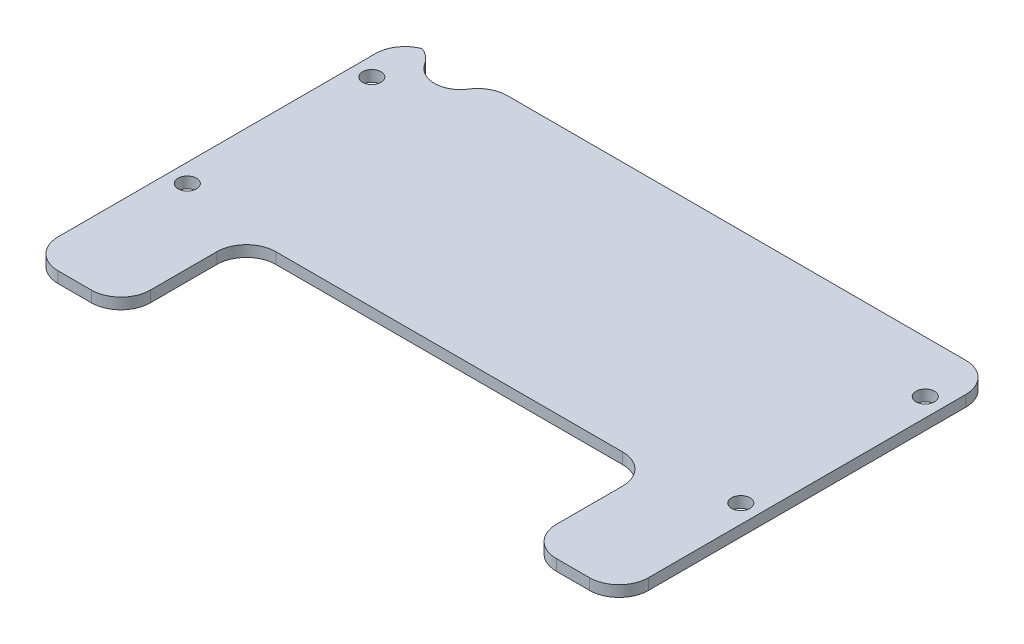
from build123d import *

# Parameters (mm, degrees)
ESQUISSE1_W             = 80
ESQUISSE1_H             = 51.00000000000001
BOSS_EXTRU_1_DEPTH      = 1.5
ESQUISSE2_R             = 1.2500000000000047
ESQUISSE2_R_2           = 1.250000000000005
ESQUISSE2_W             = 55.00000000000001
ESQUISSE2_H             = 17
ENL_V_MAT_EXTRU_1_DEPTH = 65.83247642964135
CONG_1_R                = 4


with BuildPart() as part:
    # Esquisse1 → Boss.-Extru.1 (new body)
    with BuildSketch(Plane(origin=(0, 0, 0), x_dir=(1, 0, 0), z_dir=(0, 1, 0))):
        with Locations((0, -25.500000000000004)):
            Rectangle(ESQUISSE1_W, ESQUISSE1_H)
    extrude(amount=BOSS_EXTRU_1_DEPTH)

    # Esquisse2 → Enlèv. mat.-Extru.1 (cut, through all)
    with BuildSketch(Plane(origin=(0, 1.5, 0), x_dir=(1, 0, 0), z_dir=(0, 1, 0))):
        with Locations(Location((-37.5, -32.00000000000001, 0), (0, 0, 270))):
            Circle(ESQUISSE2_R)
        with Locations(Location((-37.5, -7.000000000000006, 0), (0, 0, 270))):
            Circle(ESQUISSE2_R_2)
        with Locations(Location((37.5, -7.000000000000006, 0), (0, 0, 90))):
            Circle(ESQUISSE2_R_2)
        with Locations(Location((37.5, -32.00000000000001, 0), (0, 0, 90))):
            Circle(ESQUISSE2_R)
        with Locations((0, -42.49999999999999)):
            Rectangle(ESQUISSE2_W, ESQUISSE2_H)
        with BuildLine():
            Line((-36.00000000000001, -1.029e-14), (-29.000000000000004, -9.31e-15))
            ThreePointArc((-29.000000000000004, -9.31e-15), (-32.5, -3.5000000000000115), (-36.00000000000001, -1.029e-14))
        make_face()
    extrude(amount=-ENL_V_MAT_EXTRU_1_DEPTH, mode=Mode.SUBTRACT)

    # Congé1
    # the kernel refuses this fillet: 4 mm, written as the material it adds along each edge
    with BuildSketch(Plane(origin=(-27.5, 1.5, 33.99999999999999), x_dir=(0, 0, 1), z_dir=(0, -1, 0))) as cong_1_piece_1:
        with BuildLine():
            CenterArc((CONG_1_R, -CONG_1_R), CONG_1_R, 90, 90)
            Line((0, -CONG_1_R), (0, 0))
            Line((0, 0), (CONG_1_R, 0))
        make_face()
    extrude(amount=1.5)
    with BuildSketch(Plane(origin=(27.5, 1.5, 33.99999999999999), x_dir=(0, 0, 1), z_dir=(0, -1, 0))) as cong_1_piece_2:
        with BuildLine():
            CenterArc((CONG_1_R, CONG_1_R), CONG_1_R, 180, 90)
            Line((0, CONG_1_R), (0, 0))
            Line((0, 0), (CONG_1_R, 0))
        make_face()
    extrude(amount=1.5)
    # the kernel refuses this fillet: 4 mm, written as the material it takes off along each edge
    with BuildSketch(Plane(origin=(-27.5, 11.5, 51), x_dir=(-1, 0, 0), z_dir=(0, -1, 0)), Plane(origin=(40, -10, 51), x_dir=(0, 0, -1), z_dir=(0, 1, 0)), Plane(origin=(-40, -10, 51), x_dir=(1, 0, 0), z_dir=(0, 1, 0))) as cong_1_2_piece_1:
        with BuildLine():
            CenterArc((CONG_1_R, CONG_1_R), CONG_1_R, 180, 90)
            Line((0, CONG_1_R), (0, 0))
            Line((0, 0), (CONG_1_R, 0))
        make_face()
    extrude(amount=21.5, mode=Mode.SUBTRACT)
    with BuildSketch(Plane(origin=(27.5, 11.5, 51), x_dir=(1, 0, 0), z_dir=(0, -1, 0))) as cong_1_2_piece_2:
        with BuildLine():
            CenterArc((CONG_1_R, -CONG_1_R), CONG_1_R, 90, 90)
            Line((0, -CONG_1_R), (0, 0))
            Line((0, 0), (CONG_1_R, 0))
        make_face()
    extrude(amount=21.5, mode=Mode.SUBTRACT)
    with BuildSketch(Plane(origin=(-29, 8.610721925562018, 0), x_dir=(-0.27757416183489847, 0, 0.9607042128988784), z_dir=(0, -1, 0))) as cong_1_2_piece_3:
        with BuildLine():
            CenterArc((3.0533157801839375, -3.842816851595507), CONG_1_R, 106.11547631775109, 57.76904736449852)
            Line((-0.7895010714115829, -2.732520204255937), (0, 0))
            ThreePointArc((0, 0), (0.9715095664221598, -0.13753525485392898), (1.9430191328443203, 7e-17))
        make_face()
    extrude(amount=15.721443851124036, mode=Mode.SUBTRACT)
    with BuildSketch(Plane(origin=(-36, 8.610721925562018, 0), x_dir=(-1, 0, 0), z_dir=(0, -1, 0))) as cong_1_2_piece_4:
        with BuildLine():
            CenterArc((2.844288770224807, -4), CONG_1_R, 90, 57.769047364498164)
            ThreePointArc((-0.5393319072284086, -1.8666666666666827), (-0.1375352548539297, -0.9715095664221669), (0, 0))
            Line((0, 0), (2.844288770224807, 0))
        make_face()
    extrude(amount=15.721443851124036, mode=Mode.SUBTRACT)
    with BuildSketch(Plane(origin=(-40, -10, 0), x_dir=(0, 0, 1), z_dir=(0, 1, 0))) as cong_1_2_piece_5:
        with BuildLine():
            CenterArc((CONG_1_R, CONG_1_R), CONG_1_R, 180, 90)
            Line((-4.4e-16, CONG_1_R), (0, 0))
            Line((0, 0), (CONG_1_R, 0))
        make_face()
    extrude(amount=21.5, mode=Mode.SUBTRACT)
    with BuildSketch(Plane(origin=(40, -10, 0), x_dir=(-1, 0, 0), z_dir=(0, 1, 0))) as cong_1_2_piece_6:
        with BuildLine():
            CenterArc((CONG_1_R, CONG_1_R), CONG_1_R, 180, 90)
            Line((0, CONG_1_R), (0, 0))
            Line((0, 0), (CONG_1_R, 0))
        make_face()
    extrude(amount=21.5, mode=Mode.SUBTRACT)


solid = part.part
